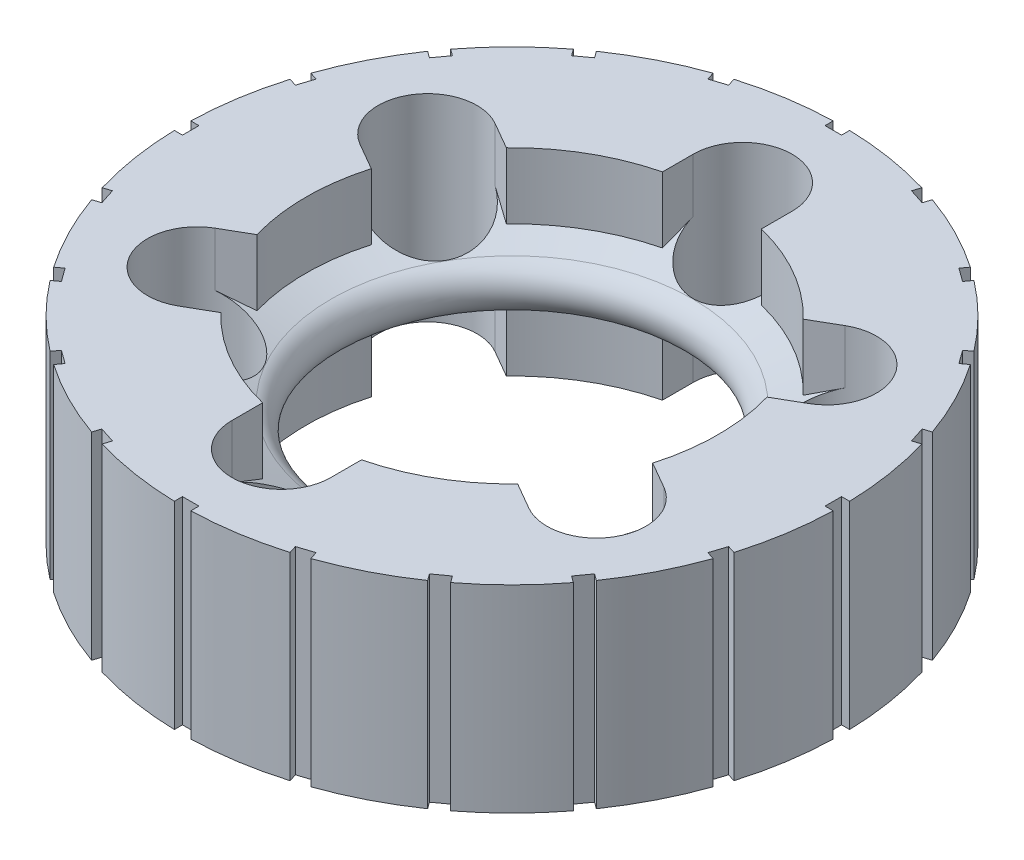
from build123d import *
from build123d.topology import SkipClean

# Parameters (mm, degrees)
SKETCH1_R                    = 25.4
BOSS_EXTRUDE1_DEPTH          = 7.62
CUT_EXTRUDE4_DEPTH           = 0.635
CIRPATTERN2_COUNT            = 20
BODY_MOVE_COPY1_START        = -7.62
BODY_MOVE_COPY1_DEPTH        = 15.24
BOSS_EXTRUDE2_REACH          = 41.01
SKETCH5_R                    = 3.81
SKETCH5_R_2                  = 1.905
BOSS_EXTRUDE6_REACH          = 41.01
SKETCH12_R                   = 3.81
SKETCH17_R                   = 1.905
CUT_EXTRUDE5_DEPTH           = 37.709371419
CIRPATTERN1_COUNT            = 3
CIRPATTERN1_2_COUNT          = 3
CUT_EXTRUDE7_DEPTH           = 40.009885324
BODY_DELETE_KEEP_START       = -7.62
BODY_DELETE_KEEP_4_OUTLINE_R = 1.905
BODY_DELETE_KEEP_4_DEPTH     = 15.24


# Read off the part's stored shape, not the designer's step: Body-Move/Copy1, Body-Delete/Keep 4
with BuildPart() as part:
    # Sketch1 → Boss-Extrude1 (new, symmetric)
    with BuildSketch(Plane(origin=(0, 0, 0), x_dir=(1, 0, 0), z_dir=(0, 1, 0))):
        with Locations(Location((0, 0, 0), (0, 0, 90))):
            Circle(SKETCH1_R)
    extrude(amount=BOSS_EXTRUDE1_DEPTH, both=True)

    # Sketch9 → Cut-Extrude4 (cut)
    with BuildSketch(Plane.ZY.offset(25.4)):
        Polygon((-0.635, -7.62), (0.635, -7.62), (0.635, 0), (0.635, 7.62), (-0.635, 7.62), (-0.635, 0), align=None)
    cut_extrude4 = extrude(amount=-CUT_EXTRUDE4_DEPTH, mode=Mode.SUBTRACT)

    # CirPattern2: Cut-Extrude4 ×20 about axis
    cirpattern2_axis = Axis((0, 0, 0), (0, 1, 0))
    for i in range(1, CIRPATTERN2_COUNT):
        add(cut_extrude4.rotate(cirpattern2_axis, i * 360 / CIRPATTERN2_COUNT), mode=Mode.SUBTRACT)

    # Sketch4 → Cut-Revolve2 (revolve, cut)
    with BuildSketch(Plane.XY, mode=Mode.PRIVATE) as cut_revolve2_sk:
        with BuildLine():
            Line((-25.4, -7.62), (-22.225, -7.62))
            Line((-22.225, -7.62), (-22.225, -5.08))
            Line((-22.225, -5.08), (-13.94687024, -1.768748096))
            ThreePointArc((-13.94687024, -1.768748096), (-12.749369479, 0), (-13.94687024, 1.768748096))
            Line((-13.94687024, 1.768748096), (-22.225, 5.08))
            Line((-22.225, 5.08), (-22.225, 7.62))
            Line((-22.225, 7.62), (-25.4, 7.62))
            Line((-25.4, 7.62), (-25.4, -7.62))
        make_face()
    revolve(cut_revolve2_sk.sketch.rotate(Axis((0, -55, 0), (0, 1, 0)), 270), axis=Axis((0, -55, 0), (0, 1, 0)), mode=Mode.SUBTRACT)

    # Sketch5 → Boss-Extrude2 (add, up to next)
    with BuildSketch(Plane(origin=(0, 7.62, 0), x_dir=(1, 0, 0), z_dir=(0, 1, 0)), mode=Mode.PRIVATE) as boss_extrude2_sk1:
        with Locations(Location((0, 17.78, 0), (0, 0, 135.677409987))):
            Circle(SKETCH5_R)
        with Locations(Location((0, 17.78, 0), (0, 0, 167.128322052))):
            Circle(SKETCH5_R_2, mode=Mode.SUBTRACT)
    boss_extrude2_tool1 = extrude(boss_extrude2_sk1.sketch, amount=-BOSS_EXTRUDE2_REACH, mode=Mode.PRIVATE) - part.part
    boss_extrude2 = boss_extrude2_tool1.solids().sort_by_distance((2.648644, 7.62, -15.193257))[0]
    add(boss_extrude2)

    # Sketch12 → Boss-Extrude6 (add, up to next)
    with BuildSketch(Plane(origin=(0, 7.62, 0), x_dir=(1, 0, 0), z_dir=(0, 1, 0)), mode=Mode.PRIVATE) as boss_extrude6_sk1:
        with Locations(Location((-15.397931679, 8.89, 0), (0, 0, 134.328577967))):
            Circle(SKETCH12_R)
    boss_extrude6_tool1 = extrude(boss_extrude6_sk1.sketch, amount=-BOSS_EXTRUDE6_REACH, mode=Mode.PRIVATE) - part.part
    boss_extrude6 = boss_extrude6_tool1.solids().sort_by_distance((-15.397932, 7.62, -8.89))[0]
    add(boss_extrude6)

    # Sketch17 → Cut-Extrude5 (cut, symmetric)
    with BuildSketch(Plane(origin=(0, 0, 0), x_dir=(1, 0, 0), z_dir=(0, 1, 0))):
        with Locations(Location((0, 17.78, 0), (0, 0, 270))):
            Circle(SKETCH17_R)
        with Locations(Location((-15.397931679, 8.89, 0), (0, 0, 270))):
            Circle(SKETCH17_R)
        with Locations(Location((-15.397931679, -8.89, 0), (0, 0, 270))):
            Circle(SKETCH17_R)
        with BuildLine():
            Line((-18.697488468, -10.795), (-19.247414599, -11.1125))
            ThreePointArc((-19.247414599, -11.1125), (-19.247414599, 11.1125), (0, 22.225))
            Line((0, 22.225), (0, 21.59))
            ThreePointArc((0, 21.59), (-2.694076836, 20.474076836), (-3.81, 17.78))
            Line((-3.81, 17.78), (-3.81, 15.411019596))
            ThreePointArc((-3.81, 15.411019596), (-7.9375, 13.748153285), (-11.441334469, 11.005066587))
            Line((-11.441334469, 11.005066587), (-13.492931679, 12.189556788))
            ThreePointArc((-13.492931679, 12.189556788), (-18.697488468, 10.795), (-17.302931679, 5.590443212))
            Line((-17.302931679, 5.590443212), (-15.251334469, 4.40595301))
            ThreePointArc((-15.251334469, 4.40595301), (-15.875, 0), (-15.251334469, -4.40595301))
            Line((-15.251334469, -4.40595301), (-17.302931679, -5.590443212))
            ThreePointArc((-17.302931679, -5.590443212), (-19.078109077, -7.903899438), (-18.697488468, -10.795))
        make_face()
    cut_extrude5 = extrude(amount=CUT_EXTRUDE5_DEPTH, both=True, mode=Mode.SUBTRACT)

    # CirPattern1: Boss-Extrude2, Boss-Extrude6 ×3 about axis
    cirpattern1_axis = Axis((0, 0, 0), (0, 1, 0))
    add([boss_extrude2.rotate(cirpattern1_axis, i * 360 / CIRPATTERN1_COUNT) for i in range(1, CIRPATTERN1_COUNT)])
    add([boss_extrude6.rotate(cirpattern1_axis, i * 360 / CIRPATTERN1_COUNT) for i in range(1, CIRPATTERN1_COUNT)])

    # CirPattern1 2: Cut-Extrude5 ×3 about axis
    with SkipClean():  # the faces are left unmerged after this step: merging them gives an invalid solid
        cirpattern1_2_axis = Axis((0, 0, 0), (0, 1, 0))
        for i in range(1, CIRPATTERN1_2_COUNT):
            add(cut_extrude5.rotate(cirpattern1_2_axis, i * 360 / CIRPATTERN1_2_COUNT), mode=Mode.SUBTRACT)

    # Sketch24 → Cut-Extrude7 (cut, through all)
    with BuildSketch(Plane.XZ.offset(7.62)):
        Polygon((5.499261314, -9.525), (10.998522628, 0), (5.499261314, 9.525), (-5.499261314, 9.525), (-10.998522628, 0), (-5.499261314, -9.525), align=None)
    extrude(amount=-CUT_EXTRUDE7_DEPTH, mode=Mode.SUBTRACT)


with BuildPart() as body_2:
    # Body-Move/Copy1 outline → Body-Move/Copy1 (new body)
    with BuildSketch(Plane(origin=(0, 0, 0), x_dir=(1, 0, 0), z_dir=(0, 1, 0)).offset(BODY_MOVE_COPY1_START)):
        with BuildLine():
            ThreePointArc((-23.953059531, -8.450499339), (-22.631565714, -11.531358693), (-20.915852716, -14.411353342))
            Line((-20.915852716, -14.411353342), (-20.408549501, -14.042775982))
            Line((-20.408549501, -14.042775982), (-19.66206223, -15.070227564))
            Line((-19.66206223, -15.070227564), (-20.169365446, -15.438804925))
            ThreePointArc((-20.169365446, -15.438804925), (-17.960512242, -17.960512242), (-15.438804925, -20.169365446))
            Line((-15.438804925, -20.169365446), (-15.070227564, -19.66206223))
            Line((-15.070227564, -19.66206223), (-14.042775982, -20.408549501))
            Line((-14.042775982, -20.408549501), (-14.411353342, -20.915852716))
            ThreePointArc((-14.411353342, -20.915852716), (-11.531358693, -22.631565714), (-8.450499339, -23.953059531))
            Line((-8.450499339, -23.953059531), (-8.256726754, -23.356688835))
            Line((-8.256726754, -23.356688835), (-7.048884978, -23.749140417))
            Line((-7.048884978, -23.749140417), (-7.242657564, -24.345511114))
            ThreePointArc((-7.242657564, -24.345511114), (-3.973435412, -25.087283851), (-0.635, -25.392061259))
            Line((-0.635, -25.392061259), (-0.635, -24.765))
            Line((-0.635, -24.765), (0.635, -24.765))
            Line((0.635, -24.765), (0.635, -25.392061259))
            ThreePointArc((0.635, -25.392061259), (3.973435412, -25.087283851), (7.242657564, -24.345511114))
            Line((7.242657564, -24.345511114), (7.048884978, -23.749140417))
            Line((7.048884978, -23.749140417), (8.256726754, -23.356688835))
            Line((8.256726754, -23.356688835), (8.450499339, -23.953059531))
            ThreePointArc((8.450499339, -23.953059531), (11.531358693, -22.631565714), (14.411353342, -20.915852716))
            Line((14.411353342, -20.915852716), (14.042775982, -20.408549501))
            Line((14.042775982, -20.408549501), (15.070227564, -19.66206223))
            Line((15.070227564, -19.66206223), (15.438804925, -20.169365446))
            ThreePointArc((15.438804925, -20.169365446), (17.960512242, -17.960512242), (20.169365446, -15.438804925))
            Line((20.169365446, -15.438804925), (19.66206223, -15.070227564))
            Line((19.66206223, -15.070227564), (20.408549501, -14.042775982))
            Line((20.408549501, -14.042775982), (20.915852716, -14.411353342))
            ThreePointArc((20.915852716, -14.411353342), (22.631565714, -11.531358693), (23.953059531, -8.450499339))
            Line((23.953059531, -8.450499339), (23.356688835, -8.256726754))
            Line((23.356688835, -8.256726754), (23.749140417, -7.048884978))
            Line((23.749140417, -7.048884978), (24.345511114, -7.242657564))
            ThreePointArc((24.345511114, -7.242657564), (25.087283851, -3.973435412), (25.392061259, -0.635))
            Line((25.392061259, -0.635), (24.765, -0.635))
            Line((24.765, -0.635), (24.765, 0.635))
            Line((24.765, 0.635), (25.392061259, 0.635))
            ThreePointArc((25.392061259, 0.635), (25.087283851, 3.973435412), (24.345511114, 7.242657564))
            Line((24.345511114, 7.242657564), (23.749140417, 7.048884978))
            Line((23.749140417, 7.048884978), (23.356688835, 8.256726754))
            Line((23.356688835, 8.256726754), (23.953059531, 8.450499339))
            ThreePointArc((23.953059531, 8.450499339), (22.631565714, 11.531358693), (20.915852716, 14.411353342))
            Line((20.915852716, 14.411353342), (20.408549501, 14.042775982))
            Line((20.408549501, 14.042775982), (19.66206223, 15.070227564))
            Line((19.66206223, 15.070227564), (20.169365446, 15.438804925))
            ThreePointArc((20.169365446, 15.438804925), (17.960512242, 17.960512242), (15.438804925, 20.169365446))
            Line((15.438804925, 20.169365446), (15.070227564, 19.66206223))
            Line((15.070227564, 19.66206223), (14.042775982, 20.408549501))
            Line((14.042775982, 20.408549501), (14.411353342, 20.915852716))
            ThreePointArc((14.411353342, 20.915852716), (11.531358693, 22.631565714), (8.450499339, 23.953059531))
            Line((8.450499339, 23.953059531), (8.256726754, 23.356688835))
            Line((8.256726754, 23.356688835), (7.048884978, 23.749140417))
            Line((7.048884978, 23.749140417), (7.242657564, 24.345511114))
            ThreePointArc((7.242657564, 24.345511114), (3.973435412, 25.087283851), (0.635, 25.392061259))
            Line((0.635, 25.392061259), (0.635, 24.765))
            Line((0.635, 24.765), (-0.635, 24.765))
            Line((-0.635, 24.765), (-0.635, 25.392061259))
            ThreePointArc((-0.635, 25.392061259), (-3.973435412, 25.087283851), (-7.242657564, 24.345511114))
            Line((-7.242657564, 24.345511114), (-7.048884978, 23.749140417))
            Line((-7.048884978, 23.749140417), (-8.256726754, 23.356688835))
            Line((-8.256726754, 23.356688835), (-8.450499339, 23.953059531))
            ThreePointArc((-8.450499339, 23.953059531), (-11.531358693, 22.631565714), (-14.411353342, 20.915852716))
            Line((-14.411353342, 20.915852716), (-14.042775982, 20.408549501))
            Line((-14.042775982, 20.408549501), (-15.070227564, 19.66206223))
            Line((-15.070227564, 19.66206223), (-15.438804925, 20.169365446))
            ThreePointArc((-15.438804925, 20.169365446), (-17.960512242, 17.960512242), (-20.169365446, 15.438804925))
            Line((-20.169365446, 15.438804925), (-19.66206223, 15.070227564))
            Line((-19.66206223, 15.070227564), (-20.408549501, 14.042775982))
            Line((-20.408549501, 14.042775982), (-20.915852716, 14.411353342))
            ThreePointArc((-20.915852716, 14.411353342), (-22.631565714, 11.531358693), (-23.953059531, 8.450499339))
            Line((-23.953059531, 8.450499339), (-23.356688835, 8.256726754))
            Line((-23.356688835, 8.256726754), (-23.749140417, 7.048884978))
            Line((-23.749140417, 7.048884978), (-24.345511114, 7.242657564))
            ThreePointArc((-24.345511114, 7.242657564), (-25.087283851, 3.973435412), (-25.392061259, 0.635))
            Line((-25.392061259, 0.635), (-24.765, 0.635))
            Line((-24.765, 0.635), (-24.765, -0.635))
            Line((-24.765, -0.635), (-25.392061259, -0.635))
            ThreePointArc((-25.392061259, -0.635), (-25.087283851, -3.973435412), (-24.345511114, -7.242657564))
            Line((-24.345511114, -7.242657564), (-23.749140417, -7.048884978))
            Line((-23.749140417, -7.048884978), (-23.356688835, -8.256726754))
            Line((-23.356688835, -8.256726754), (-23.953059531, -8.450499339))
        make_face()
    extrude(amount=BODY_MOVE_COPY1_DEPTH)

    # Combine3: cut part
    add(part.part, mode=Mode.SUBTRACT)

    # Body-Delete/Keep 4 outline → Body-Delete/Keep 4 (cut)
    with BuildSketch(Plane(origin=(0, 0, 0), x_dir=(1, 0, 0), z_dir=(0, 1, 0)).offset(BODY_DELETE_KEEP_START)):
        Polygon((5.499261314, -9.525), (10.998522628, 0), (5.499261314, 9.525), (-5.499261314, 9.525), (-10.998522628, 0), (-5.499261314, -9.525), align=None)
        with Locations((-15.397931679, 8.89)):
            Circle(BODY_DELETE_KEEP_4_OUTLINE_R)
        with Locations((-15.397931679, -8.89)):
            Circle(BODY_DELETE_KEEP_4_OUTLINE_R)
        with Locations((0, 17.78)):
            Circle(BODY_DELETE_KEEP_4_OUTLINE_R)
        with Locations((0, -17.78)):
            Circle(BODY_DELETE_KEEP_4_OUTLINE_R)
        with Locations((15.397931679, 8.89)):
            Circle(BODY_DELETE_KEEP_4_OUTLINE_R)
        with Locations((15.397931679, -8.89)):
            Circle(BODY_DELETE_KEEP_4_OUTLINE_R)
    extrude(amount=BODY_DELETE_KEEP_4_DEPTH, mode=Mode.SUBTRACT)


solid = body_2.part
